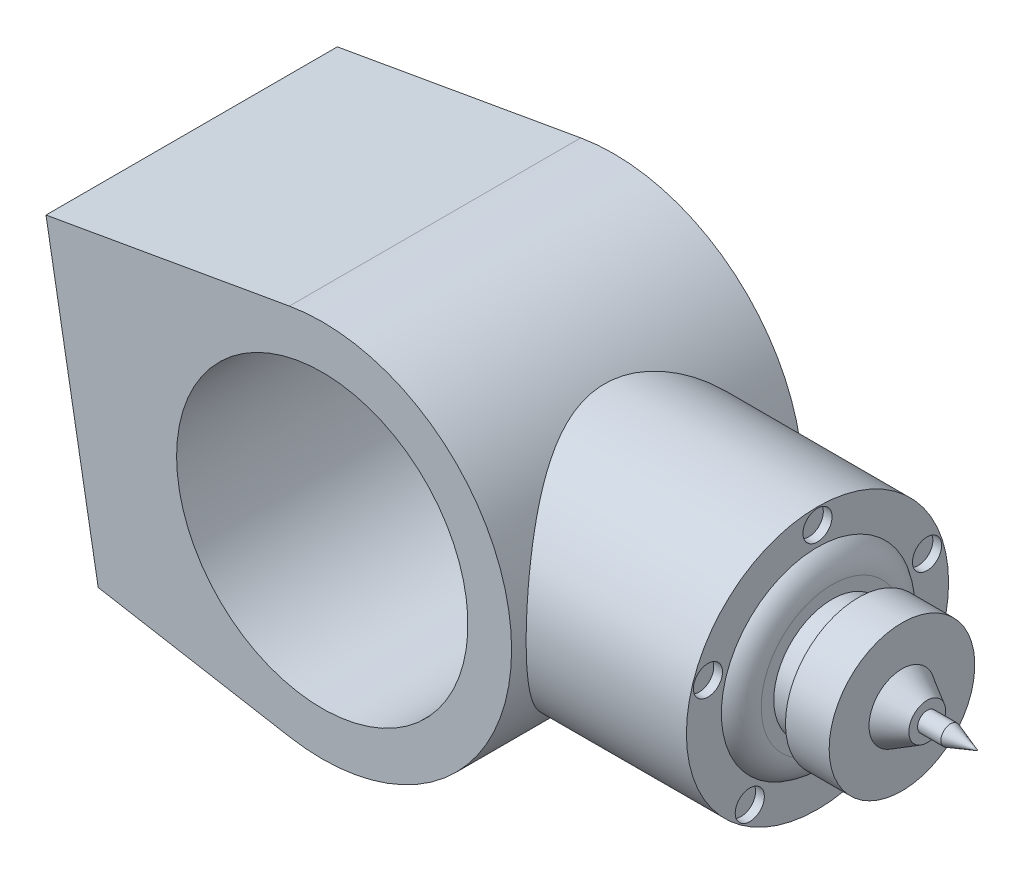
from build123d import *

# Parameters (mm, degrees)
SKETCH1_R                = 50
BOSS_EXTRUDE1_DEPTH      = 50
BOSS_EXTRUDE2_REACH      = 281.962
BOSS_EXTRUDE2_END_RADIUS = 65
SKETCH2_R                = 45
SKETCH4_R                = 5
CUT_EXTRUDE4_DEPTH       = 3
CIRPATTERN2_COUNT        = 5
SKETCH5_R                = 33
BOSS_EXTRUDE3_DEPTH      = 5
FILLET1_R                = 10
SKETCH6_W                = 100
SKETCH6_H                = 80
CUT_EXTRUDE5_DEPTH       = 37
SKETCH7_W                = 37.232866149
SKETCH7_H                = 100
CUT_EXTRUDE6_DEPTH       = 8
SKETCH8_W                = 37
SKETCH8_H                = 100
CUT_EXTRUDE7_DEPTH       = 8
SKETCH9_W                = 16.438055999
SKETCH9_H                = 100
CUT_EXTRUDE8_DEPTH       = 138
CUT_EXTRUDE9_DEPTH       = 138
CUT_EXTRUDE10_DEPTH      = 138


with BuildPart() as part:
    # Sketch1 → Boss-Extrude1 (new, symmetric)
    with BuildSketch(Plane.XY):
        with BuildLine():
            Line((-147.681836523, 40), (-147.681836523, -40))
            Line((-147.681836523, -40), (-11.270034193, -64.015516317))
            ThreePointArc((-11.270034193, -64.015516317), (65, 0), (-11.270034193, 64.015516317))
            Line((-11.270034193, 64.015516317), (-147.681836523, 40))
        make_face()
        with Locations(Location((0, 0, 0), (0, 0, 180))):
            Circle(SKETCH1_R, mode=Mode.SUBTRACT)
    extrude(amount=BOSS_EXTRUDE1_DEPTH, both=True)

    # Boss-Extrude2: up to this cylinder (the profile starts outside it)
    boss_extrude2_end = Plane(origin=(0, 0, 0), z_dir=(0, 0, -1)) * Cylinder(BOSS_EXTRUDE2_END_RADIUS, 694.924, mode=Mode.PRIVATE)
    # Sketch2 → Boss-Extrude2 (add, up to the surface)
    with BuildSketch(Plane(origin=(120, 0, 0), x_dir=(0, 0, -1), z_dir=(1, 0, 0)), mode=Mode.PRIVATE) as boss_extrude2_sk1:
        Circle(SKETCH2_R)
    boss_extrude2_tool1 = extrude(boss_extrude2_sk1.sketch, amount=-BOSS_EXTRUDE2_REACH, mode=Mode.PRIVATE) - boss_extrude2_end
    add(boss_extrude2_tool1.solids().sort_by_distance((120, 0, 0))[0])

    # Sketch3 → Revolve1 (revolve)
    with BuildSketch(Plane.XY, mode=Mode.PRIVATE) as revolve1_sk:
        Polygon((175.096490443, 0), (120, 0), (120, -20), (134, -20), (134, -25), (149, -25), (149, -11.31020279), (157.660254038, -6.31020279), (157.660254038, -3.31020279), (165.660254038, -3.31020279), align=None)
    revolve(revolve1_sk.sketch.rotate(Axis((0, 0, 0), (1, 0, 0)), 270), axis=Axis((0, 0, 0), (1, 0, 0)))

    # Sketch4 → Cut-Extrude4 (cut)
    with BuildSketch(Plane(origin=(120, 0, 0), x_dir=(0, 0, -1), z_dir=(1, 0, 0))):
        with Locations((0, 39.542976343)):
            Circle(SKETCH4_R)
    cut_extrude4 = extrude(amount=-CUT_EXTRUDE4_DEPTH, mode=Mode.SUBTRACT)

    # CirPattern2: Cut-Extrude4 ×5 about axis
    cirpattern2_axis = Axis((0, 0, 0), (1, 0, 0))
    for i in range(1, CIRPATTERN2_COUNT):
        add(cut_extrude4.rotate(cirpattern2_axis, i * 360 / CIRPATTERN2_COUNT), mode=Mode.SUBTRACT)

    # Sketch5 → Boss-Extrude3 (add)
    with BuildSketch(Plane(origin=(120, 0, 0), x_dir=(0, 0, -1), z_dir=(1, 0, 0))):
        Circle(SKETCH5_R)
    extrude(amount=BOSS_EXTRUDE3_DEPTH)

    # Fillet1
    # the kernel refuses this fillet: 10 mm, written as the material it takes off along each edge
    with BuildSketch(Plane(origin=(125, 0, 0), x_dir=(0, 0, -1), z_dir=(0, -1, 0))) as fillet1_piece_1:
        with BuildLine():
            CenterArc((24.339745962, -10), FILLET1_R, 30, 60)
            Line((24.339745962, 0), (24.339745962, 0.2))
            Line((24.339745962, 0.2), (33, 0.2))
            Line((33, 0.2), (33.2, 0))
            ThreePointArc((33.2, 0), (33.2, -2.5), (33.173205081, -4.9))
            Line((33.173205081, -4.9), (33, -5))
        make_face()
    revolve(axis=Axis((125, 0, 0), (1, 0, 0)), mode=Mode.SUBTRACT)

    # Sketch6 → Cut-Extrude5 (cut)
    with BuildSketch(Plane.ZY.offset(147.681836523)):
        Rectangle(SKETCH6_W, SKETCH6_H)
    extrude(amount=-CUT_EXTRUDE5_DEPTH, mode=Mode.SUBTRACT)

    # Sketch7 → Cut-Extrude6 (cut)
    with BuildSketch(Plane(origin=(-11.270034193, 64.015516317, 0), x_dir=(0.9848540971786934, 0.17338514143472855, 0), z_dir=(-0.17338514143472852, 0.9848540971786933, 0))):
        with Locations((-119.893223046, 0)):
            Rectangle(SKETCH7_W, SKETCH7_H)
    extrude(amount=-CUT_EXTRUDE6_DEPTH, mode=Mode.SUBTRACT)

    # Sketch8 → Cut-Extrude7 (cut)
    with BuildSketch(Plane(origin=(0, -40, 0), x_dir=(1, 0, 0), z_dir=(0, 1, 0))):
        with Locations((-129.181836523, 0)):
            Rectangle(SKETCH8_W, SKETCH8_H)
    extrude(amount=-CUT_EXTRUDE7_DEPTH, mode=Mode.SUBTRACT)

    # Sketch9 → Cut-Extrude8 (cut)
    with BuildSketch(Plane(origin=(-11.270034193, 64.015516317, 0), x_dir=(0.9848540971786934, 0.17338514143472855, 0), z_dir=(-0.17338514143472852, 0.9848540971786933, 0))):
        with Locations((-93.057761973, 0)):
            Rectangle(SKETCH9_W, SKETCH9_H)
    extrude(amount=-CUT_EXTRUDE8_DEPTH, mode=Mode.SUBTRACT)


with BuildPart() as cut_extrude8_piece_1:
    # of the separate pieces the step leaves, piece 1, a body of its own (cut_extrude8_pieces)
    add(part.part.solids().sort_by_distance((-11.270034193, 64.015516317, 50))[0])


with BuildPart() as cut_extrude8_piece_2:
    # of the separate pieces the step leaves, piece 2, a body of its own (cut_extrude8_pieces)
    add(part.part.solids().sort_by_distance((-109.625814615, 38.576792986, 50))[0])

    # Sketch10 → Cut-Extrude9 (cut)
    with BuildSketch(Plane.XY.offset(50)):
        Polygon((-110.681836523, -46.51390927), (-110.681836523, 38.390878637), (-107.391706575, 38.390878637), (-90.237190338, -50.805264009), (-110.681836523, -50.805264009), align=None)
    extrude(amount=-CUT_EXTRUDE9_DEPTH, mode=Mode.SUBTRACT)

    # Sketch11 → Cut-Extrude10 (cut)
    with BuildSketch(Plane(origin=(-9.882953062, 56.136683539, 0), x_dir=(0.9848540971786934, 0.17338514143472858, 0), z_dir=(-0.17338514143472855, 0.9848540971786933, 0))):
        Polygon((-96.059625261, -51.911327494), (-97.962360053, 56.770253773), (-112.335310265, 50), (-108.517558636, -51.911327494), align=None)
    extrude(amount=-CUT_EXTRUDE10_DEPTH, mode=Mode.SUBTRACT)


solid = cut_extrude8_piece_1.part
